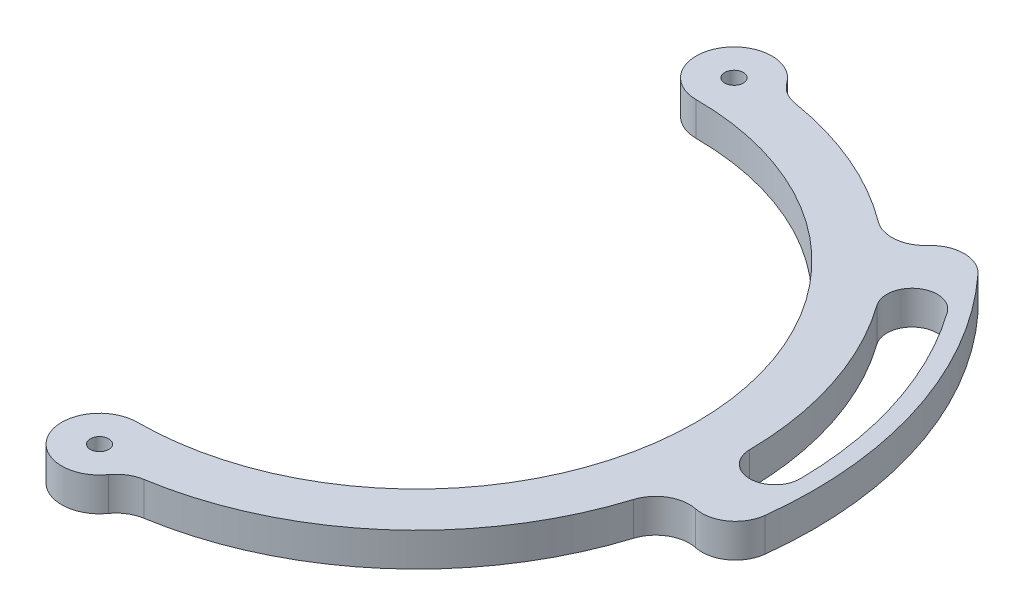
from build123d import *

# Parameters (mm, degrees)
BOSS_EXTRUDE1_DEPTH  = 5
M5_CLEARANCE_HOLE1_D = 5.5
FILLET1_R            = 10


with BuildPart() as part:
    # Sketch1 → Boss-Extrude1 (new, symmetric)
    with BuildSketch(Plane(origin=(0, 0, 0), x_dir=(1, 0, 0), z_dir=(0, 1, 0))):
        with BuildLine():
            ThreePointArc((115.470324267, -24.543975101), (112.272221749, 36.479456186), (78.990868081, 87.728246648))
            Line((78.990868081, 87.728246648), (65.608255953, 72.865350138))
            ThreePointArc((65.608255953, 72.865350138), (40.133036877, 89.460280857), (10.798978706, 97.45349947))
            ThreePointArc((10.798978706, 97.45349947), (-9.001093518, 101.04854173), (0, 83.05))
            ThreePointArc((0, 83.05), (83.05, 0), (0, -83.05))
            ThreePointArc((0, -83.05), (-9.001093518, -101.04854173), (10.798978706, -97.45349947))
            ThreePointArc((10.798978706, -97.45349947), (65.813533347, -72.679992628), (95.907372252, -20.385741285))
            Line((95.907372252, -20.385741285), (115.470324267, -24.543975101))
        make_face()
        with BuildLine():
            ThreePointArc((113.045695402, 0.986534838), (105.611429996, -6.578628601), (98.046266556, 0.855636806))
            ThreePointArc((98.046266556, 0.855636806), (93.251091423, 30.299116298), (79.824026575, 56.937924807))
            ThreePointArc((79.824026575, 56.937924807), (81.574620795, 67.399063363), (92.03575935, 65.648469143))
            ThreePointArc((92.03575935, 65.648469143), (107.516939167, 34.934371214), (113.045695402, 0.986534838))
        make_face(mode=Mode.SUBTRACT)
    extrude(amount=BOSS_EXTRUDE1_DEPTH, both=True)

    # M5 Clearance Hole1 (through all)
    with Locations(Plane(origin=(0, 5, 0), x_dir=(1, 0, 0), z_dir=(0, 1, 0))):
        with Locations((0, -94.3), (0, 94.3)):
            Hole(M5_CLEARANCE_HOLE1_D / 2)

    # Fillet1
    # the kernel refuses this fillet: 10 mm, written as the material it adds along each edge
    with BuildSketch(Plane(origin=(10.798978706, 5, 97.45349947), x_dir=(0.990831071127436, 0, -0.13510658195831074), z_dir=(0, -1, 0)), Plane(origin=(10.798978706, -5, -97.45349947), x_dir=(0.990831071127436, 0, 0.13510658195831213), z_dir=(0, 1, 0))) as fillet1_piece_1:
        with BuildLine():
            CenterArc((5.184861326, 9.996835122), FILLET1_R, 223.325173882, 45.233283105)
            ThreePointArc((-2.089852288, 3.13545466), (-0.912718127, 1.655846999), (0, 0))
            ThreePointArc((0, 0), (2.466645575, 0.031031634), (4.93329115, 0))
        make_face()
    extrude(amount=10)
    with BuildSketch(Plane(origin=(65.608255953, -5, -72.865350138), x_dir=(0.6691306063588537, 0, -0.7431448254773984), z_dir=(0, 1, 0)), Plane(origin=(95.907372252, 5, 20.385741285), x_dir=(0.9781476007338056, 0, 0.20791169081775965), z_dir=(0, -1, 0))) as fillet1_piece_2:
        with BuildLine():
            CenterArc((9.536256092, 10), FILLET1_R, 185.31030916, 84.68969084)
            ThreePointArc((-0.420824527, 9.074502545), (-0.105262635, 4.542127523), (0, 0))
            Line((0, 0), (9.536256092, 0))
        make_face()
    extrude(amount=10)
    # the kernel refuses this fillet: 10 mm, written as the material it takes off along each edge
    with BuildSketch(Plane(origin=(78.990868081, -32.343098115, -87.728246648), x_dir=(0.7113498032891118, 0, 0.7028381444973957), z_dir=(0, 1, 0))) as fillet1_2_piece_1:
        with BuildLine():
            CenterArc((10.473993196, -9.989264392), FILLET1_R, 87.34484542, 95.31030916)
            Line((0.484728804, -10.452510442), (0, 0))
            ThreePointArc((0, 0), (5.468619623, 0.12673385), (10.937239246, 0))
        make_face()
    extrude(amount=64.68619623, mode=Mode.SUBTRACT)
    with BuildSketch(Plane(origin=(115.470324267, -32.343098115, 24.543975101), x_dir=(-0.9781476007338059, 0, -0.2079116908177584), z_dir=(0, 1, 0))) as fillet1_2_piece_2:
        with BuildLine():
            CenterArc((10.463743908, -10), FILLET1_R, 90, 95.31030916)
            ThreePointArc((0.506663288, -10.925497455), (0.12673385, -5.468619623), (0, 0))
            Line((0, 0), (10.463743908, 0))
        make_face()
    extrude(amount=64.68619623, mode=Mode.SUBTRACT)


solid = part.part
